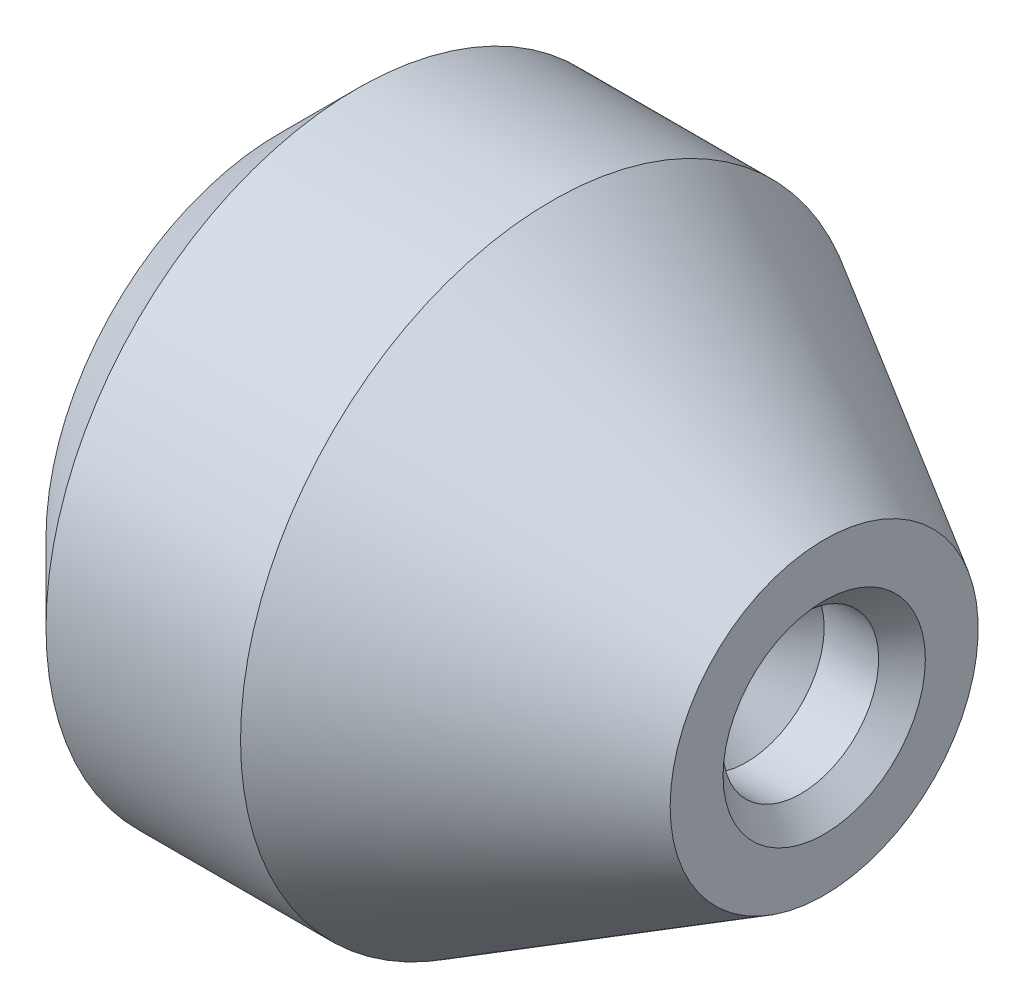
from build123d import *

# Parameters (mm, degrees)
SKETCH2_R          = 1
CUT_EXTRUDE1_DEPTH = 0.3
CHAMFER1_SIZE      = 0.3
SKETCH3_R          = 1
CUT_EXTRUDE2_DEPTH = 0.7


with BuildPart() as part:
    # Sketch1 → Revolve1 (revolve)
    with BuildSketch(Plane(origin=(0, 0, 0), x_dir=(1, 0, 0), z_dir=(0, 1, 0)), mode=Mode.PRIVATE) as revolve1_sk:
        Polygon((0, 0), (0, 2.5), (-3, 2.5), (-3, 3), (-2, 4), (0.5, 4), (4, 1.979274058), (4, 0), align=None)
    revolve(revolve1_sk.sketch.rotate(Axis((-1.085106383, 0, 0), (1, 0, 0)), 180), axis=Axis((-1.085106383, 0, 0), (1, 0, 0)))

    # Sketch2 → Cut-Extrude1 (cut)
    with BuildSketch(Plane(origin=(4, 0, 0), x_dir=(0, 0, -1), z_dir=(1, 0, 0))):
        Circle(SKETCH2_R)
    extrude(amount=-CUT_EXTRUDE1_DEPTH, mode=Mode.SUBTRACT)

    # Chamfer1
    chamfer1_edges = [part.edges().sort_by_distance(p)[0] for p in [
        (4, 0, 1),
    ]]
    chamfer(chamfer1_edges, length=CHAMFER1_SIZE - 0.0001)  # a hair under: the kernel refuses the full size

    # Sketch3 → Cut-Extrude2 (cut)
    with BuildSketch(Plane(origin=(3.7, 0, 0), x_dir=(0, 0, -1), z_dir=(1, 0, 0))):
        Circle(SKETCH3_R)
    extrude(amount=-CUT_EXTRUDE2_DEPTH, mode=Mode.SUBTRACT)

    # Cut-Extrude3 cone 1 section (through the dimple's axis) → Cut-Extrude3 (revolve, cut)
    with BuildSketch(Plane(origin=(3, 0, 0), x_dir=(0, 0, -1), z_dir=(0, 1, 0))):
        Polygon((0, 0), (1, 0), (0, 1), align=None)
    revolve(axis=Axis((3, 0, 0), (-1, 0, 0)), mode=Mode.SUBTRACT)


solid = part.part
